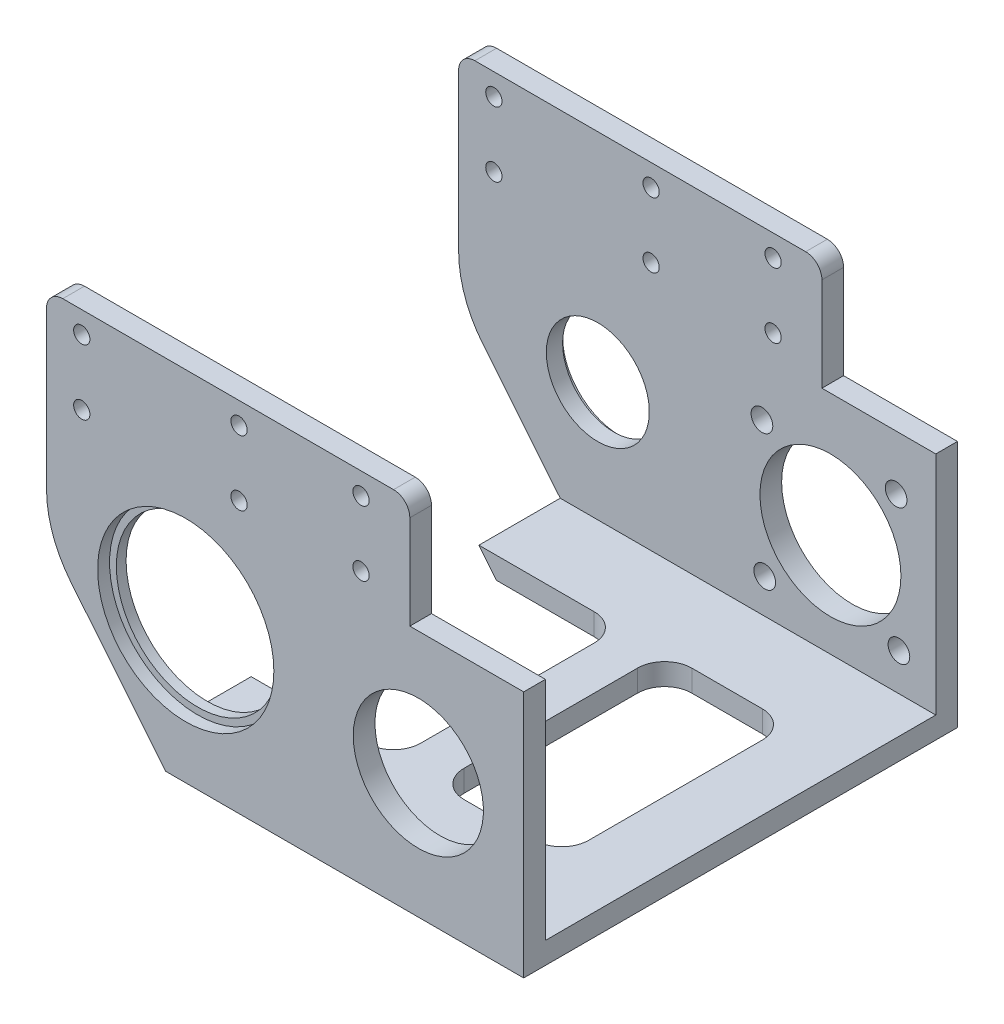
from build123d import *

# Parameters (mm, degrees)
EXTRUDE_1_DEPTH      = 4
SKETCH_3_W           = 70
SKETCH_3_H           = 4
EXTRUDE_2_DEPTH      = 5
SKETCH_4_W           = 70
SKETCH_4_H           = 4
EXTRUDE_3_DEPTH      = 4
SKETCH_4_2_W         = 70
SKETCH_4_2_H         = 4
EXTRUDE_4_DEPTH      = 81
EXTRUDE_5_DEPTH      = 4
SKETCH_6_W           = 70
SKETCH_6_H           = 4
EXTRUDE_6_DEPTH      = 76
SKETCH_7_W           = 70
SKETCH_7_H           = 4
EXTRUDE_7_DEPTH      = 95
SKETCH_8_W           = 30
SKETCH_8_H           = 20.3
CUT_EXTRUDE_2_DEPTH  = 80
SKETCH_11_W          = 70
SKETCH_11_H          = 99
CUT_EXTRUDE_4_DEPTH  = 155
SKETCH_14_W          = 5
SKETCH_14_H          = 99
CUT_EXTRUDE_7_DEPTH  = 81.8
SKETCH_15_W          = 65
SKETCH_15_H          = 72
EXTRUDE_8_DEPTH      = 8
SKETCH_16_W          = 65
SKETCH_16_H          = 80
CUT_EXTRUDE_8_DEPTH  = 8
SKETCH_17_W          = 6
SKETCH_17_H          = 70.7
CUT_EXTRUDE_9_DEPTH  = 102
FILLET_2_R           = 3
EXTRUDE_10_DEPTH     = 33
SKETCH_22_R          = 9.5
CUT_EXTRUDE_12_DEPTH = 333
SKETCH_23_R          = 10.5
CUT_EXTRUDE_13_DEPTH = 1
SKETCH_25_R          = 1.5
CUT_EXTRUDE_15_DEPTH = 92
EXTRUDE_11_DEPTH     = 8
SKETCH_27_R          = 1.5
CUT_EXTRUDE_16_DEPTH = 88
SKETCH_28_R          = 1.5
EXTRUDE_12_DEPTH     = 4
EXTRUDE_START        = -4
SKETCH_30_R          = 1.5
EXTRUDE_13_DEPTH     = 4
FILLET_3_R           = 3
SKETCH_34_R          = 15
CUT_EXTRUDE_19_DEPTH = 10
SKETCH_46_W          = 100
SKETCH_46_H          = 72
EXTRUDE_14_DEPTH     = 14
SKETCH_47_W          = 100
SKETCH_47_H          = 80
CUT_EXTRUDE_26_DEPTH = 14
SKETCH_48_W          = 4
SKETCH_48_H          = 56.7
CUT_EXTRUDE_27_DEPTH = 97
FILLET_4_R           = 3
CUT_EXTRUDE_28_DEPTH = 82
SKETCH_51_W          = 36
SKETCH_51_H          = 36
CUT_EXTRUDE_29_DEPTH = 82
FILLET_6_R           = 5
SKETCH_52_R          = 13
SKETCH_52_R_2        = 2
CUT_EXTRUDE_30_DEPTH = 10
SKETCH_53_R          = 12
CUT_EXTRUDE_31_DEPTH = 10
SKETCH_54_W          = 74.594594595
SKETCH_54_H          = 72
EXTRUDE_15_DEPTH     = 11
SKETCH_55_W          = 72
SKETCH_55_H          = 80
CUT_EXTRUDE_32_DEPTH = 11
SKETCH_57_W          = 80
SKETCH_57_H          = 11
CUT_EXTRUDE_33_DEPTH = 14
SKETCH_58_W          = 8
SKETCH_58_H          = 45.7
CUT_EXTRUDE_34_DEPTH = 115
CUT_EXTRUDE_35_DEPTH = 115
EXTRUDE_16_DEPTH     = 80
FILLET_7_R           = 20
SKETCH_61_W          = 42
SKETCH_61_H          = 42
CUT_EXTRUDE_36_DEPTH = 4
SKETCH_63_W          = 9
SKETCH_63_H          = 20.3
CUT_EXTRUDE_37_DEPTH = 108.522090753
FILLET_9_R           = 3
SKETCH_65_R          = 9.5
EXTRUDE_17_DEPTH     = 4
SKETCH_66_R          = 15
EXTRUDE_18_DEPTH     = 4
SKETCH_67_R          = 9.5
CUT_EXTRUDE_39_DEPTH = 4
SKETCH_68_R          = 15
CUT_EXTRUDE_40_DEPTH = 4
SKETCH_69_R          = 10.5
CUT_EXTRUDE_41_DEPTH = 1
SKETCH_70_R          = 16.25
CUT_EXTRUDE_42_DEPTH = 2.2
SKETCH_71_W          = 22.207028064
SKETCH_71_H          = 42
CUT_EXTRUDE_44_DEPTH = 8.2
SKETCH_72_W          = 8
SKETCH_72_H          = 42
EXTRUDE_19_DEPTH     = 4
FILLET_10_R          = 5


with BuildPart() as part:
    # 草图1 → 凸台-拉伸1 (new body)
    with BuildSketch(Plane.XY):
        Polygon((-20, 45), (20, 45), (20, 24.7), (50, 24.7), (50, -45), (20, -45), (-20, -45), align=None)
    extrude(amount=EXTRUDE_1_DEPTH)

    # 草图3 → 凸台-拉伸2 (add)
    with BuildSketch(Plane.XZ.offset(45)):
        with Locations((15, 2)):
            Rectangle(SKETCH_3_W, SKETCH_3_H)
    extrude(amount=EXTRUDE_2_DEPTH)

    # 草图4 → 凸台-拉伸3 (add)
    with BuildSketch(Plane(origin=(0, 0, 0), x_dir=(-1, 0, 0), z_dir=(0, 0, -1))):
        with Locations((-15, -52)):
            Rectangle(SKETCH_4_W, SKETCH_4_H)
    extrude(amount=-EXTRUDE_3_DEPTH)

    # 草图4<2> → 凸台-拉伸4 (add)
    with BuildSketch(Plane(origin=(0, 0, 0), x_dir=(-1, 0, 0), z_dir=(0, 0, -1))):
        with Locations((-15, -52)):
            Rectangle(SKETCH_4_2_W, SKETCH_4_2_H)
    extrude(amount=EXTRUDE_4_DEPTH)

    # 草图5 → 凸台-拉伸5 (add)
    with BuildSketch(Plane(origin=(0, 0, -81), x_dir=(-1, 0, 0), z_dir=(0, 0, -1))):
        Polygon((-50, -50), (-50, -54), (20, -54), (20, -50), (20, 45), (-20, 45), (-20, 24.7), (-50, 24.7), align=None)
    extrude(amount=EXTRUDE_5_DEPTH)

    # 草图6 → 凸台-拉伸6 (add)
    with BuildSketch(Plane.XY.offset(4)):
        with Locations((15, -52)):
            Rectangle(SKETCH_6_W, SKETCH_6_H)
    extrude(amount=EXTRUDE_6_DEPTH)

    # 草图7 → 凸台-拉伸7 (add)
    with BuildSketch(Plane(origin=(0, -50, 0), x_dir=(1, 0, 0), z_dir=(0, 1, 0))):
        with Locations((15, -78)):
            Rectangle(SKETCH_7_W, SKETCH_7_H)
    extrude(amount=EXTRUDE_7_DEPTH)

    # 草图8 → 切除-拉伸2 (cut)
    with BuildSketch(Plane.XY.offset(80)):
        with Locations((35, 34.85)):
            Rectangle(SKETCH_8_W, SKETCH_8_H)
    extrude(amount=-CUT_EXTRUDE_2_DEPTH, mode=Mode.SUBTRACT)

    # 草图11 → 切除-拉伸4 (cut)
    with BuildSketch(Plane(origin=(0, 0, 0), x_dir=(-1, 0, 0), z_dir=(0, 0, -1))):
        with Locations((-15, -4.5)):
            Rectangle(SKETCH_11_W, SKETCH_11_H)
    extrude(amount=CUT_EXTRUDE_4_DEPTH, mode=Mode.SUBTRACT)

    # 草图14 → 切除-拉伸7 (cut)
    with BuildSketch(Plane.XY.offset(80)):
        with Locations((-17.5, -4.5)):
            Rectangle(SKETCH_14_W, SKETCH_14_H)
    extrude(amount=-CUT_EXTRUDE_7_DEPTH, mode=Mode.SUBTRACT)

    # 草图15 → 凸台-拉伸8 (add)
    with BuildSketch(Plane(origin=(0, -50, 0), x_dir=(1, 0, 0), z_dir=(0, 1, 0))):
        with Locations((17.5, -40)):
            Rectangle(SKETCH_15_W, SKETCH_15_H)
    extrude(amount=EXTRUDE_8_DEPTH)

    # 草图16 → 切除-拉伸8 (cut)
    with BuildSketch(Plane.XZ.offset(54)):
        with Locations((17.5, 40)):
            Rectangle(SKETCH_16_W, SKETCH_16_H)
    extrude(amount=-CUT_EXTRUDE_8_DEPTH, mode=Mode.SUBTRACT)

    # 草图17 → 切除-拉伸9 (cut)
    with BuildSketch(Plane(origin=(0, 0, 0), x_dir=(-1, 0, 0), z_dir=(0, 0, -1))):
        with Locations((-47, -10.65)):
            Rectangle(SKETCH_17_W, SKETCH_17_H)
    extrude(amount=-CUT_EXTRUDE_9_DEPTH, mode=Mode.SUBTRACT)

    # 圆角2
    fillet_2_edges = [part.edges().sort_by_distance(p)[0] for p in [
        (44, 24.7, 78),
        (44, 24.7, 2),
    ]]
    fillet(fillet_2_edges, radius=FILLET_2_R)

    # 草图21 → 凸台-拉伸10 (add)
    with BuildSketch(Plane.ZY.offset(15)):
        Polygon((0, -46), (80, -46), (80, 45), (76, 45), (76, -42), (4, -42), (4, 45), (0, 45), align=None)
    extrude(amount=EXTRUDE_10_DEPTH)

    # 草图22 → 切除-拉伸12 (cut)
    with BuildSketch(Plane.XY.offset(80)):
        with Locations((-29, 13)):
            Circle(SKETCH_22_R)
    extrude(amount=-CUT_EXTRUDE_12_DEPTH, mode=Mode.SUBTRACT)

    # 草图23 → 切除-拉伸13 (cut)
    with BuildSketch(Plane.XY.offset(80)):
        with Locations((-29, 13)):
            Circle(SKETCH_23_R)
    extrude(amount=-CUT_EXTRUDE_13_DEPTH, mode=Mode.SUBTRACT)

    # 草图25 → 切除-拉伸15 (cut)
    with BuildSketch(Plane(origin=(0, 0, 0), x_dir=(-1, 0, 0), z_dir=(0, 0, -1))):
        with Locations((-2, 41)):
            Circle(SKETCH_25_R)
        with Locations((-2, 29)):
            Circle(SKETCH_25_R)
        with Locations((43, 41)):
            Circle(SKETCH_25_R)
        with Locations((43, 29)):
            Circle(SKETCH_25_R)
        with Locations((20.5, 41)):
            Circle(SKETCH_25_R)
        with Locations((20.5, 29)):
            Circle(SKETCH_25_R)
    extrude(amount=-CUT_EXTRUDE_15_DEPTH, mode=Mode.SUBTRACT)

    # 草图26 → 凸台-拉伸11 (add)
    with BuildSketch(Plane.ZY.offset(48)):
        Polygon((0, 45), (0, -46), (80, -46), (80, 45), (76, 45), (76, -42), (4, -42), (4, 45), align=None)
    extrude(amount=EXTRUDE_11_DEPTH)

    # 草图27 → 切除-拉伸16 (cut)
    with BuildSketch(Plane(origin=(0, 0, 0), x_dir=(-1, 0, 0), z_dir=(0, 0, -1))):
        with Locations((49.5, 41)):
            Circle(SKETCH_27_R)
        with Locations((49.5, 29)):
            Circle(SKETCH_27_R)
    extrude(amount=-CUT_EXTRUDE_16_DEPTH, mode=Mode.SUBTRACT)

    # 草图28 → 凸台-拉伸12 (add)
    with BuildSketch(Plane(origin=(0, 0, 0), x_dir=(-1, 0, 0), z_dir=(0, 0, -1))):
        with Locations((43, 41)):
            Circle(SKETCH_28_R)
        with Locations((43, 29)):
            Circle(SKETCH_28_R)
    extrude(amount=-EXTRUDE_12_DEPTH)

    # 草图30 → 凸台-拉伸13 (add)
    with BuildSketch(Plane.XY.offset(80).offset(EXTRUDE_START)):
        with Locations((-43, 41)):
            Circle(SKETCH_30_R)
        with Locations((-43, 29)):
            Circle(SKETCH_30_R)
    extrude(amount=EXTRUDE_13_DEPTH)

    # 圆角3
    fillet_3_edges = [part.edges().sort_by_distance(p)[0] for p in [
        (20, 45, 78),
        (20, 45, 2),
        (-56, 45, 2),
        (-56, 45, 78),
    ]]
    fillet(fillet_3_edges, radius=FILLET_3_R)

    # 草图34 → 切除-拉伸19 (cut)
    with BuildSketch(Plane.XY.offset(80)):
        with Locations((-29, 13)):
            Circle(SKETCH_34_R)
    extrude(amount=-CUT_EXTRUDE_19_DEPTH, mode=Mode.SUBTRACT)

    # 草图46 → 凸台-拉伸14 (add)
    with BuildSketch(Plane(origin=(0, -42, 0), x_dir=(1, 0, 0), z_dir=(0, 1, 0))):
        with Locations((-6, -40)):
            Rectangle(SKETCH_46_W, SKETCH_46_H)
    extrude(amount=EXTRUDE_14_DEPTH)

    # 草图47 → 切除-拉伸26 (cut)
    with BuildSketch(Plane.XZ.offset(46)):
        with Locations((-6, 40)):
            Rectangle(SKETCH_47_W, SKETCH_47_H)
    extrude(amount=-CUT_EXTRUDE_26_DEPTH, mode=Mode.SUBTRACT)

    # 草图48 → 切除-拉伸27 (cut)
    with BuildSketch(Plane(origin=(0, 0, 0), x_dir=(-1, 0, 0), z_dir=(0, 0, -1))):
        with Locations((-42, -3.65)):
            Rectangle(SKETCH_48_W, SKETCH_48_H)
    extrude(amount=-CUT_EXTRUDE_27_DEPTH, mode=Mode.SUBTRACT)

    # 圆角4
    fillet_4_edges = [part.edges().sort_by_distance(p)[0] for p in [
        (40, 24.7, 78),
        (40, 24.7, 2),
    ]]
    fillet(fillet_4_edges, radius=FILLET_4_R)

    # 草图49 → 切除-拉伸28 (cut)
    with BuildSketch(Plane.XY.offset(80)):
        Polygon((-56, -32), (-32, -32), (-56, 5), align=None)
    extrude(amount=-CUT_EXTRUDE_28_DEPTH, mode=Mode.SUBTRACT)

    # 草图51 → 切除-拉伸29 (cut)
    with BuildSketch(Plane.XZ.offset(32)):
        with Locations((4, 40)):
            Rectangle(SKETCH_51_W, SKETCH_51_H)
    extrude(amount=-CUT_EXTRUDE_29_DEPTH, mode=Mode.SUBTRACT)

    # 圆角6
    fillet_6_edges = [part.edges().sort_by_distance(p)[0] for p in [
        (22, -30, 58),
        (22, -30, 22),
        (-14, -30, 22),
        (-14, -30, 58),
    ]]
    fillet(fillet_6_edges, radius=FILLET_6_R)

    # 草图52 → 切除-拉伸30 (cut)
    with BuildSketch(Plane(origin=(0, 0, 0), x_dir=(-1, 0, 0), z_dir=(0, 0, -1))):
        with Locations((-12.569219382, 2)):
            Circle(SKETCH_52_R)
        with Locations((0.061332194, 14.112768754)):
            Circle(SKETCH_52_R_2)
        with Locations((-0.456450627, -10.630551576)):
            Circle(SKETCH_52_R_2)
        with Locations((-25.199770957, -10.112768754)):
            Circle(SKETCH_52_R_2)
        with Locations((-24.681988136, 14.630551576)):
            Circle(SKETCH_52_R_2)
    extrude(amount=-CUT_EXTRUDE_30_DEPTH, mode=Mode.SUBTRACT)

    # 草图53 → 切除-拉伸31 (cut)
    with BuildSketch(Plane(origin=(0, 0, 76), x_dir=(-1, 0, 0), z_dir=(0, 0, -1))):
        with Locations((-12.569219382, 2)):
            Circle(SKETCH_53_R)
    extrude(amount=-CUT_EXTRUDE_31_DEPTH, mode=Mode.SUBTRACT)

    # 草图54 → 凸台-拉伸15 (add)
    with BuildSketch(Plane(origin=(0, -28, 0), x_dir=(1, 0, 0), z_dir=(0, 1, 0))):
        with Locations((2.702702702, -40)):
            Rectangle(SKETCH_54_W, SKETCH_54_H)
    extrude(amount=EXTRUDE_15_DEPTH)

    # 草图55 → 切除-拉伸32 (cut)
    with BuildSketch(Plane.XZ.offset(32)):
        with Locations((4, 40)):
            Rectangle(SKETCH_55_W, SKETCH_55_H)
    extrude(amount=-CUT_EXTRUDE_32_DEPTH, mode=Mode.SUBTRACT)

    # 草图57 → 切除-拉伸33 (cut)
    with BuildSketch(Plane(origin=(-32, 0, 0), x_dir=(0, 0, -1), z_dir=(1, 0, 0))):
        with Locations((-40, -26.5)):
            Rectangle(SKETCH_57_W, SKETCH_57_H)
    extrude(amount=-CUT_EXTRUDE_33_DEPTH, mode=Mode.SUBTRACT)

    # 草图58 → 切除-拉伸34 (cut)
    with BuildSketch(Plane.XY.offset(80)):
        with Locations((36, 1.85)):
            Rectangle(SKETCH_58_W, SKETCH_58_H)
    extrude(amount=-CUT_EXTRUDE_34_DEPTH, mode=Mode.SUBTRACT)

    # 草图59 → 切除-拉伸35 (cut)
    with BuildSketch(Plane.XY.offset(80)):
        Polygon((-34, -21), (-56, 5.985419262), (-56, -21), align=None)
    extrude(amount=-CUT_EXTRUDE_35_DEPTH, mode=Mode.SUBTRACT)

    # 凸台-拉伸16: read off the stored shape, not the designer's step
    # 凸台-拉伸16 outline → 凸台-拉伸16 (add)
    with BuildSketch(Plane.XY):
        Polygon((-37.261020299, -17), (-34.594594595, -20.270664344), (-34.594594595, -17), align=None)
    extrude(amount=EXTRUDE_16_DEPTH)

    # 圆角7
    fillet_7_edges = [part.edges().sort_by_distance(p)[0] for p in [
        (-56, 5.985419262, 2),
        (-56, 5.985419262, 78),
    ]]
    fillet(fillet_7_edges, radius=FILLET_7_R)

    # 草图61 → 切除-拉伸36 (cut)
    with BuildSketch(Plane.XZ.offset(21)):
        with Locations((-1, 40)):
            Rectangle(SKETCH_61_W, SKETCH_61_H)
    extrude(amount=-CUT_EXTRUDE_36_DEPTH, mode=Mode.SUBTRACT)

    # 草图63 → 切除-拉伸37 (cut, through all)
    with BuildSketch(Plane(origin=(0, 0, 0), x_dir=(-1, 0, 0), z_dir=(0, 0, -1))):
        with Locations((-15.5, 34.85)):
            Rectangle(SKETCH_63_W, SKETCH_63_H)
    extrude(amount=-CUT_EXTRUDE_37_DEPTH, mode=Mode.SUBTRACT)

    # 圆角9
    fillet_9_edges = [part.edges().sort_by_distance(p)[0] for p in [
        (11, 45, 78),
        (11, 45, 2),
    ]]
    fillet(fillet_9_edges, radius=FILLET_9_R)

    # 草图65 → 凸台-拉伸17 (add)
    with BuildSketch(Plane(origin=(0, 0, 0), x_dir=(-1, 0, 0), z_dir=(0, 0, -1)).offset(EXTRUDE_START)):
        with Locations((29, 13)):
            Circle(SKETCH_65_R)
    extrude(amount=EXTRUDE_17_DEPTH)

    # 草图66 → 凸台-拉伸18 (add)
    with BuildSketch(Plane.XY.offset(80)):
        with Locations((-29, 13)):
            Circle(SKETCH_66_R)
    extrude(amount=-EXTRUDE_18_DEPTH)

    # 草图67 → 切除-拉伸39 (cut)
    with BuildSketch(Plane(origin=(0, 0, 0), x_dir=(-1, 0, 0), z_dir=(0, 0, -1))):
        with Locations((30.326001797, 5)):
            Circle(SKETCH_67_R)
    extrude(amount=-CUT_EXTRUDE_39_DEPTH, mode=Mode.SUBTRACT)

    # 草图68 → 切除-拉伸40 (cut)
    with BuildSketch(Plane(origin=(0, 0, 76), x_dir=(-1, 0, 0), z_dir=(0, 0, -1))):
        with Locations((30.326001797, 5)):
            Circle(SKETCH_68_R)
    extrude(amount=-CUT_EXTRUDE_40_DEPTH, mode=Mode.SUBTRACT)

    # 草图69 → 切除-拉伸41 (cut)
    with BuildSketch(Plane(origin=(0, 0, 0), x_dir=(-1, 0, 0), z_dir=(0, 0, -1))):
        with Locations((30.326001797, 5)):
            Circle(SKETCH_69_R)
    extrude(amount=-CUT_EXTRUDE_41_DEPTH, mode=Mode.SUBTRACT)

    # 草图70 → 切除-拉伸42 (cut)
    with BuildSketch(Plane.XY.offset(80)):
        with Locations((-30.326001797, 5)):
            Circle(SKETCH_70_R)
    extrude(amount=-CUT_EXTRUDE_42_DEPTH, mode=Mode.SUBTRACT)

    # 草图71 → 切除-拉伸44 (cut)
    with BuildSketch(Plane.XZ.offset(21)):
        with Locations((-33.103514032, 40)):
            Rectangle(SKETCH_71_W, SKETCH_71_H)
    extrude(amount=-CUT_EXTRUDE_44_DEPTH, mode=Mode.SUBTRACT)

    # 草图72 → 凸台-拉伸19 (add)
    with BuildSketch(Plane.XZ.offset(21)):
        with Locations((-7, 40)):
            Rectangle(SKETCH_72_W, SKETCH_72_H)
    extrude(amount=-EXTRUDE_19_DEPTH)

    # 圆角10
    fillet_10_edges = [part.edges().sort_by_distance(p)[0] for p in [
        (20, -19, 61),
        (20, -19, 19),
        (-11, -19, 61),
        (-11, -19, 19),
        (-3, -19, 19),
        (-3, -19, 61),
    ]]
    fillet(fillet_10_edges, radius=FILLET_10_R)


solid = part.part
